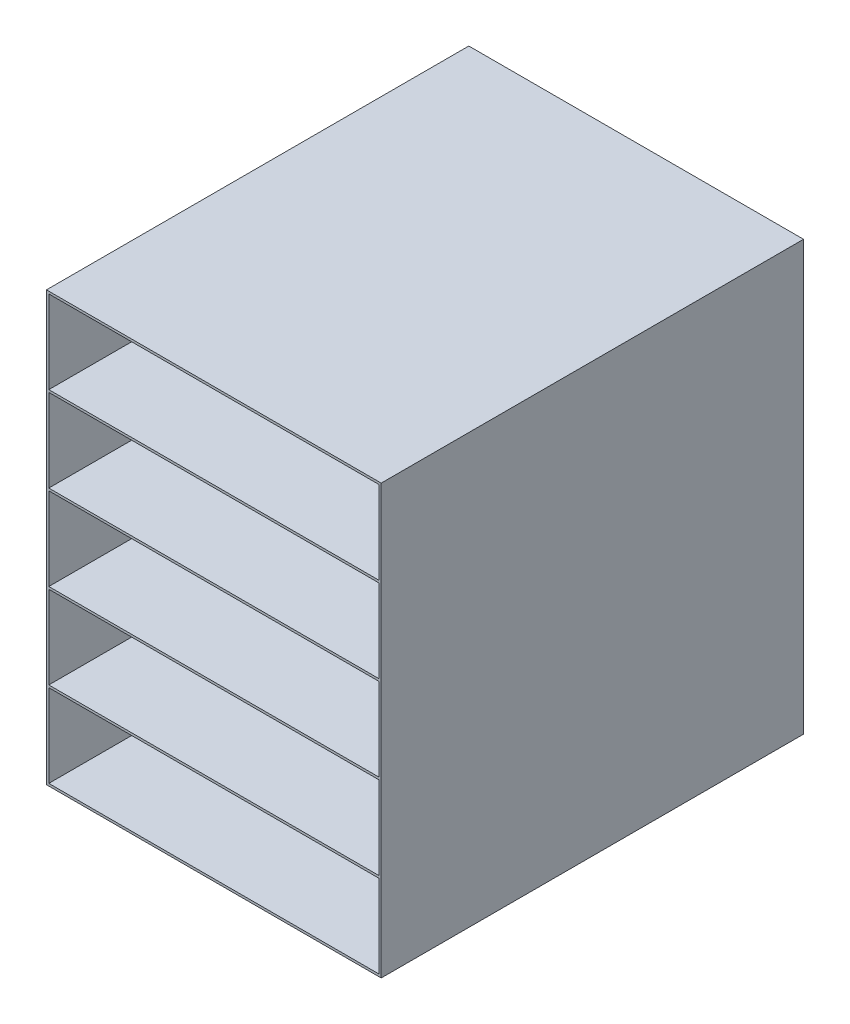
from build123d import *

# Parameters (mm, degrees)
ESBO_O1_W                = 107
ESBO_O1_H                = 28
RESSALTO_EXTRUS_O1_DEPTH = 135
CASCA1_T                 = -0.75
PADR_O_LINEAR1_OUTLINE_W = 107
PADR_O_LINEAR1_OUTLINE_H = 109
PADR_O_LINEAR1_DEPTH     = 135
ESBO_O2_W                = 105.5
ESBO_O2_H                = 26.5
CORTE_EXTRUS_O1_DEPTH    = 134.25


# Read off the part's stored shape, not the designer's step: Padrão linear1
with BuildPart() as part:
    # Esboço1 → Ressalto-extrusão1 (new body)
    with BuildSketch(Plane.XY):
        Rectangle(ESBO_O1_W, ESBO_O1_H)
    extrude(amount=RESSALTO_EXTRUS_O1_DEPTH)

    # Casca1
    casca1_openings = [part.faces().sort_by_distance(p)[0] for p in [
        (0, 0, 135),
    ]]
    offset(amount=CASCA1_T, openings=casca1_openings, kind=Kind.INTERSECTION)

    # Padrão linear1 outline → Padrão linear1 (add)
    with BuildSketch(Plane.XY):
        with Locations((0, 68.5)):
            Rectangle(PADR_O_LINEAR1_OUTLINE_W, PADR_O_LINEAR1_OUTLINE_H)
    extrude(amount=PADR_O_LINEAR1_DEPTH)

    # Esboço2 → Corte-extrusão1 (cut)
    with BuildSketch(Plane.XY.offset(135)):
        Rectangle(ESBO_O2_W, ESBO_O2_H)
        with Locations((0, 27.25)):
            Rectangle(ESBO_O2_W, ESBO_O2_H)
        with Locations((0, 54.5)):
            Rectangle(ESBO_O2_W, ESBO_O2_H)
        with Locations((0, 81.75)):
            Rectangle(ESBO_O2_W, ESBO_O2_H)
        with Locations((0, 109)):
            Rectangle(ESBO_O2_W, ESBO_O2_H)
    extrude(amount=-CORTE_EXTRUS_O1_DEPTH, mode=Mode.SUBTRACT)


solid = part.part
